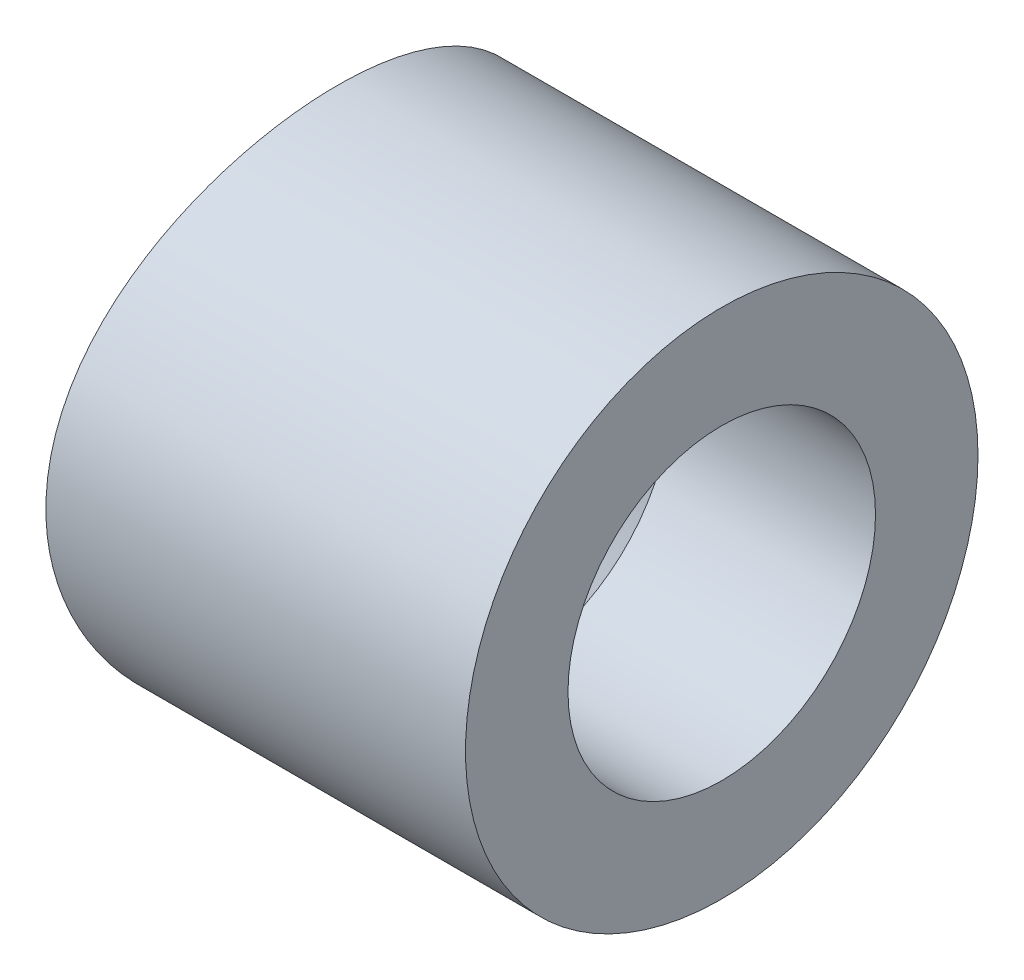
from build123d import *
from build123d.topology import SkipClean

# Parameters (mm, degrees)
SKETCH2_R                            = 23.495
INITIAL_DISK_DEPTH                   = 7.62
HOLLOW_START                         = 54.61
HOLLOW_CYLINDER_DEPTH                = 54.61
SKETCH5_R                            = 1.524
Y_SERVO_HOLE_1_DEPTH                 = 9.398
SKETCH8_R                            = 3.175
Y_SERVO_HOLE_3_DEPTH                 = 5.715
BOSS_EXTRUDE2_REACH                  = 65.924
BOSS_EXTRUDE2_DIRECTION_2_REACH      = 65.924
CUT_EXTRUDE3_DEPTH                   = 64.924034212
SKETCH9_W                            = 2.54
SKETCH9_H                            = 30.48
X_SERVO_TOP_MOUNT_DEPTH              = 6.35
FILLET3_START                        = -22
FILLET3_DEPTH                        = 45.495
SKETCH11_R                           = 2.286
X_SERVO_TOP_HOLES_DEPTH              = 2.54
X_START                              = 6.858
X_SERVO_BOTTOM_MOUNT_DEPTH           = 6.858
SKETCH14_R                           = 2.3495
X_SERVO_BOTTOM_HOLES_DEPTH           = 6.35
SKETCH15_R                           = 4.445
X_SERVO_BOTTOM_SCREW_CLEARANCE_DEPTH = 16.51
SKETCH18_W                           = 5.08
SKETCH18_H                           = 22.86
CUT_EXTRUDE2_DEPTH                   = 2.54
FILLET1_R                            = 1.27
BOSS_EXTRUDE1_DEPTH                  = 1.905
BOSS_EXTRUDE3_REACH                  = 70.14
SKETCH23_W                           = 1.905
SKETCH23_H                           = 0.757768233
BOSS_EXTRUDE4_DEPTH                  = 2.54
SKETCH24_R                           = 0.6096
CUT_EXTRUDE4_DEPTH                   = 10.16
BOSS_EXTRUDE5_REACH                  = 84.026
BOSS_EXTRUDE5_END_RADIUS             = 23.495
SKETCH16_R                           = 6.35
SKETCH16_R_2                         = 3.81
SKETCH26_R                           = 23.495
CUT_EXTRUDE5_DEPTH                   = 76.2
BOSS_EXTRUDE6_START                  = 33.2739999
BOSS_EXTRUDE6_DEPTH                  = 7.6200001
SKETCH29_R                           = 1.143
CUT_EXTRUDE6_DEPTH                   = 5.08
CHAMFER1_SIZE                        = 1.27


with BuildPart() as part:
    # Sketch2 → Initial Disk (new body)
    with BuildSketch(Plane(origin=(0, 0, 0), x_dir=(1, 0, 0), z_dir=(0, 1, 0))):
        with Locations(Location((0, 0, 0), (0, 0, 270))):
            Circle(SKETCH2_R)
    extrude(amount=-INITIAL_DISK_DEPTH)

    # Sketch3 → Hollow Cylinder (add)
    with SkipClean():  # the faces are left unmerged after this step: merging them gives an invalid solid
        with BuildSketch(Plane(origin=(0, 0, 0), x_dir=(1, 0, 0), z_dir=(0, 1, 0)).offset(HOLLOW_START)):
            with BuildLine():
                Line((-17.770847855, 11.104458182), (-20.705217543, 11.104458182))
                ThreePointArc((-20.705217543, 11.104458182), (23.495, 0), (-20.705217543, -11.104458182))
                Line((-20.705217543, -11.104458182), (-17.770847855, -11.104458182))
                ThreePointArc((-17.770847855, -11.104458182), (20.955, 0), (-17.770847855, 11.104458182))
            make_face()
        extrude(amount=-HOLLOW_CYLINDER_DEPTH)

    # Sketch5 → Y Servo Hole 1 (cut)
    with SkipClean():  # the faces are left unmerged after this step: merging them gives an invalid solid
        with BuildSketch(Plane.XZ.offset(7.62)):
            with Locations(Location((0, 0, 0), (0, 0, 270))):
                Circle(SKETCH5_R)
        extrude(amount=-Y_SERVO_HOLE_1_DEPTH, mode=Mode.SUBTRACT)

    # Sketch8 → Y Servo Hole 3 (cut)
    with SkipClean():  # the faces are left unmerged after this step: merging them gives an invalid solid
        with BuildSketch(Plane(origin=(0, 0, 0), x_dir=(1, 0, 0), z_dir=(0, 1, 0))):
            with Locations(Location((0, 0, 0), (0, 0, 270))):
                Circle(SKETCH8_R)
        extrude(amount=-Y_SERVO_HOLE_3_DEPTH, mode=Mode.SUBTRACT)

    # Sketch20 → Boss-Extrude2 (add, up to next)
    with BuildSketch(Plane(origin=(0, 0, 0), x_dir=(0, 0, -1), z_dir=(1, 0, 0)), mode=Mode.PRIVATE) as boss_extrude2_sk1:
        Polygon((23.495, 41.342827261), (14.205225637, 54.61), (11.104458182, 54.61), (21.414353808, 39.885943113), align=None)
    boss_extrude2_tool1 = extrude(boss_extrude2_sk1.sketch, amount=BOSS_EXTRUDE2_REACH, mode=Mode.PRIVATE) - part.part
    boss_extrude2 = boss_extrude2_tool1.solids().sort_by_distance((0, 47.605874, -17.532286))[0]
    add(boss_extrude2)

    # Sketch20 → Boss-Extrude2 direction 2 (add, up to next)
    with BuildSketch(Plane(origin=(0, 0, 0), x_dir=(0, 0, -1), z_dir=(1, 0, 0)), mode=Mode.PRIVATE) as boss_extrude2_direction_2_sk1:
        Polygon((23.495, 41.342827261), (14.205225637, 54.61), (11.104458182, 54.61), (21.414353808, 39.885943113), align=None)
    boss_extrude2_direction_2_tool1 = extrude(boss_extrude2_direction_2_sk1.sketch, amount=-BOSS_EXTRUDE2_DIRECTION_2_REACH, mode=Mode.PRIVATE) - part.part
    boss_extrude2_direction_2 = boss_extrude2_direction_2_tool1.solids().sort_by_distance((0, 47.605874, -17.532286))[0]
    add(boss_extrude2_direction_2)

    # Sketch21 → Cut-Extrude3 (cut, symmetric)
    with SkipClean():  # the faces are left unmerged after this step: merging them gives an invalid solid
        with BuildSketch(Plane(origin=(0, 0, 0), x_dir=(0, 0, -1), z_dir=(1, 0, 0))):
            Polygon((23.495, 54.61), (14.205225637, 54.61), (23.495, 41.342827261), align=None)
        cut_extrude3 = extrude(amount=CUT_EXTRUDE3_DEPTH, both=True, mode=Mode.SUBTRACT)

    # Mirror2: Boss-Extrude2, Boss-Extrude2 direction 2, Cut-Extrude3 across plane
    with SkipClean():  # the faces are left unmerged after this step: merging them gives an invalid solid
        add(boss_extrude2.mirror(Plane.XY))
        add(boss_extrude2_direction_2.mirror(Plane.XY))
        add(cut_extrude3.mirror(Plane.XY), mode=Mode.SUBTRACT)

    # Sketch9 → X Servo Top Mount (add)
    with SkipClean():  # the faces are left unmerged after this step: merging them gives an invalid solid
        with BuildSketch(Plane(origin=(0, 54.61, 0), x_dir=(1, 0, 0), z_dir=(0, 1, 0))):
            with Locations((-8.5344, 0)):
                Rectangle(SKETCH9_W, SKETCH9_H)
        extrude(amount=-X_SERVO_TOP_MOUNT_DEPTH)

    # Fillet3: read off the stored shape, not the designer's step
    # Fillet3 outline → Fillet3 (cut)
    with SkipClean():  # the faces are left unmerged after this step: merging them gives an invalid solid
        with BuildSketch(Plane.YZ.offset(FILLET3_START)):
            with BuildLine():
                Line((53.132189057, 15.24), (50.819094519, 16.859646232))
                ThreePointArc((50.819094519, 16.859646232), (53.605526779, 13.682328823), (54.61, 9.577382514))
                Line((54.61, 9.577382514), (54.61, 15.24))
                Line((54.61, 15.24), (53.132189057, 15.24))
            make_face()
            with BuildLine():
                ThreePointArc((54.61, -9.577384558), (53.605525966, -13.682330385), (50.81909331, -16.859647079))
                Line((50.81909331, -16.859647079), (53.132189057, -15.24))
                Line((53.132189057, -15.24), (54.61, -15.24))
                Line((54.61, -15.24), (54.61, -9.577384558))
            make_face()
        extrude(amount=FILLET3_DEPTH, mode=Mode.SUBTRACT)

    # Sketch11 → X Servo Top Holes (cut)
    with SkipClean():  # the faces are left unmerged after this step: merging them gives an invalid solid
        with BuildSketch(Plane.ZY.offset(9.8044)):
            with Locations((-4.953, 51.689)):
                Circle(SKETCH11_R)
            with Locations(Location((4.953, 51.689, 0), (0, 0, 180))):
                Circle(SKETCH11_R)
        extrude(amount=-X_SERVO_TOP_HOLES_DEPTH, mode=Mode.SUBTRACT)

    # Sketch13 → X Servo Bottom Mount (add)
    with SkipClean():  # the faces are left unmerged after this step: merging them gives an invalid solid
        with BuildSketch(Plane(origin=(0, 0, 0), x_dir=(1, 0, 0), z_dir=(0, 1, 0)).offset(X_START)):
            with BuildLine():
                Line((-9.8044, 18.519874882), (-9.8044, -18.519874882))
                ThreePointArc((-9.8044, -18.519874882), (-8.553269609, -19.129913852), (-7.2644, -19.65554674))
                Line((-7.2644, -19.65554674), (-7.2644, 19.65554674))
                ThreePointArc((-7.2644, 19.65554674), (-8.553269609, 19.129913852), (-9.8044, 18.519874882))
            make_face()
        extrude(amount=-X_SERVO_BOTTOM_MOUNT_DEPTH)

    # Sketch14 → X Servo Bottom Holes (cut)
    with SkipClean():  # the faces are left unmerged after this step: merging them gives an invalid solid
        with BuildSketch(Plane.ZY.offset(9.8044)):
            with Locations(Location((-4.953, 2.286, 0), (0, 0, 283.351184332))):
                Circle(SKETCH14_R)
            with Locations(Location((4.953, 2.286, 0), (0, 0, 283.351184332))):
                Circle(SKETCH14_R)
        extrude(amount=-X_SERVO_BOTTOM_HOLES_DEPTH, mode=Mode.SUBTRACT)

    # Sketch15 → X Servo Bottom Screw Clearance (cut)
    with SkipClean():  # the faces are left unmerged after this step: merging them gives an invalid solid
        with BuildSketch(Plane.ZY.offset(9.8044)):
            with Locations((-4.9784, 2.98958)):
                Circle(SKETCH15_R)
            with Locations((4.9784, 2.98958)):
                Circle(SKETCH15_R)
        extrude(amount=X_SERVO_BOTTOM_SCREW_CLEARANCE_DEPTH, mode=Mode.SUBTRACT)

    # Sketch18 → Cut-Extrude2 (cut)
    with SkipClean():  # the faces are left unmerged after this step: merging them gives an invalid solid
        with BuildSketch(Plane(origin=(0, 0, 0), x_dir=(1, 0, 0), z_dir=(0, 1, 0))):
            with Locations((-4.7244, 0)):
                Rectangle(SKETCH18_W, SKETCH18_H)
        extrude(amount=-CUT_EXTRUDE2_DEPTH, mode=Mode.SUBTRACT)

    # Fillet1
    fillet1_edges = [part.edges().sort_by_distance(p)[0] for p in [
        (-2.1844, -1.27, 2.304131429),
        (-2.1844, -1.27, -2.304131429),
    ]]
    fillet(fillet1_edges, radius=FILLET1_R)

    # Sketch19 → Boss-Extrude1 (add)
    with SkipClean():  # the faces are left unmerged after this step: merging them gives an invalid solid
        with BuildSketch(Plane(origin=(-7.2644, 0, 0), x_dir=(0, 0, -1), z_dir=(1, 0, 0))):
            Polygon((-8.032586336, 6.858), (-10.672231767, 2.286), (-10.672231767, -2.54), (-8.139638623, -2.54), (-1.766361377, -2.54), (0, -2.54), (0, 1.00284174), (0, 3.61315235), (-1.873413664, 6.858), align=None)
            Polygon((-2.973265927, 5.715), (-6.932734073, 5.715), (-8.912468146, 2.286), (-6.932734073, -1.143), (-2.973265927, -1.143), (-0.993531854, 2.286), align=None, mode=Mode.SUBTRACT)
        boss_extrude1 = extrude(amount=BOSS_EXTRUDE1_DEPTH)

    # Mirror1: Boss-Extrude1 across plane
    with SkipClean():  # the faces are left unmerged after this step: merging them gives an invalid solid
        add(boss_extrude1.mirror(Plane.XY))

    # Sketch22 → Boss-Extrude3 (add, up to next)
    with BuildSketch(Plane.ZY.offset(9.8044), mode=Mode.PRIVATE) as boss_extrude3_sk1:
        with BuildLine():
            ThreePointArc((11.210377262, 54.458731878), (11.157446673, 54.468457219), (11.104458182, 54.477861962))
            Line((11.104458182, 54.477861962), (11.104458182, 48.26))
            Line((11.104458182, 48.26), (15.24, 48.26))
            Line((15.24, 48.26), (15.24, 48.703834196))
            Line((15.24, 48.703834196), (11.210377262, 54.458731878))
        make_face()
    boss_extrude3_tool1 = extrude(boss_extrude3_sk1.sketch, amount=BOSS_EXTRUDE3_REACH, mode=Mode.PRIVATE) - part.part
    # Sketch22 → Boss-Extrude3 (add, up to next)
    with BuildSketch(Plane.ZY.offset(9.8044), mode=Mode.PRIVATE) as boss_extrude3_sk2:
        with BuildLine():
            Line((-15.24, 48.26), (-11.104458182, 48.26))
            Line((-11.104458182, 48.26), (-11.104458182, 54.477861962))
            ThreePointArc((-11.104458182, 54.477861962), (-11.157446673, 54.468457219), (-11.210377262, 54.458731878))
            Line((-11.210377262, 54.458731878), (-15.24, 48.703834196))
            Line((-15.24, 48.703834196), (-15.24, 48.26))
        make_face()
    boss_extrude3_tool2 = extrude(boss_extrude3_sk2.sketch, amount=BOSS_EXTRUDE3_REACH, mode=Mode.PRIVATE) - part.part
    add(boss_extrude3_tool1.solids().sort_by_distance((-9.8044, 50.384277, 12.573742))[0])
    add(boss_extrude3_tool2.solids().sort_by_distance((-9.8044, 50.384277, -12.573742))[0])

    # Sketch23 → Boss-Extrude4 (add)
    with SkipClean():  # the faces are left unmerged after this step: merging them gives an invalid solid
        with BuildSketch(Plane(origin=(0, -2.54, 0), x_dir=(1, 0, 0), z_dir=(0, 1, 0))):
            with Locations((-6.3119, 11.051115884)):
                Rectangle(SKETCH23_W, SKETCH23_H)
            with Locations((-6.3119, -11.051115884)):
                Rectangle(SKETCH23_W, SKETCH23_H)
        extrude(amount=BOSS_EXTRUDE4_DEPTH)

    # Sketch24 → Cut-Extrude4 (cut)
    with SkipClean():  # the faces are left unmerged after this step: merging them gives an invalid solid
        with BuildSketch(Plane.XZ.offset(7.62)):
            with Locations(Location((0, 6.9977, 0), (0, 0, 270))):
                Circle(SKETCH24_R)
            with Locations(Location((6.9977, 0, 0), (0, 0, 270))):
                Circle(SKETCH24_R)
            with Locations(Location((0, -6.9977, 0), (0, 0, 270))):
                Circle(SKETCH24_R)
        extrude(amount=-CUT_EXTRUDE4_DEPTH, mode=Mode.SUBTRACT)

    # Boss-Extrude5: up to this cylinder (the profile starts outside it)
    with SkipClean():  # the faces are left unmerged after this step: merging them gives an invalid solid
        boss_extrude5_end = Plane(origin=(0, 37.084, 0), z_dir=(0, 1, 0)) * Cylinder(BOSS_EXTRUDE5_END_RADIUS, 216.042, mode=Mode.PRIVATE)
        # Sketch16 → Boss-Extrude5 (add, up to the surface)
        with BuildSketch(Plane(origin=(33.02, 0, 0), x_dir=(0, 0, -1), z_dir=(1, 0, 0)), mode=Mode.PRIVATE) as boss_extrude5_sk1:
            with Locations((0, 37.084)):
                Circle(SKETCH16_R)
            with Locations((0, 37.084)):
                Circle(SKETCH16_R_2, mode=Mode.SUBTRACT)
        boss_extrude5_tool1 = extrude(boss_extrude5_sk1.sketch, amount=-BOSS_EXTRUDE5_REACH, mode=Mode.PRIVATE) - boss_extrude5_end
        add(boss_extrude5_tool1.solids().sort_by_distance((33.02, 37.084, 6.170395))[0])

    # Sketch26 → Cut-Extrude5 (cut)
    with BuildSketch(Plane(origin=(0, 54.61, 0), x_dir=(1, 0, 0), z_dir=(0, 1, 0))):
        Circle(SKETCH26_R)
    extrude(amount=-CUT_EXTRUDE5_DEPTH, mode=Mode.SUBTRACT)

    # Boss-Extrude6: read off the stored shape, not the designer's step
    # Boss-Extrude6 outline → Boss-Extrude6 (add)
    with BuildSketch(Plane(origin=(0, 0, 0), x_dir=(1, 0, 0), z_dir=(0, 1, 0)).offset(BOSS_EXTRUDE6_START)):
        with BuildLine():
            ThreePointArc((22.956807814, 5), (23.495, 0), (22.956807814, -5))
            Line((22.956807814, -5), (26.67, -5))
            Line((26.67, -5), (26.67, 5))
            Line((26.67, 5), (22.956807814, 5))
        make_face()
    extrude(amount=BOSS_EXTRUDE6_DEPTH)

    # Sketch29 → Cut-Extrude6 (cut)
    with BuildSketch(Plane(origin=(26.67, 0, 0), x_dir=(0, 0, -1), z_dir=(1, 0, 0))):
        with Locations((0, 37.084)):
            Circle(SKETCH29_R)
    extrude(amount=-CUT_EXTRUDE6_DEPTH, mode=Mode.SUBTRACT)

    # Chamfer1
    chamfer1_edges = [part.edges().sort_by_distance(p)[0] for p in [
        (26.67, 37.084, 3.81),
    ]]
    chamfer(chamfer1_edges, length=CHAMFER1_SIZE)


solid = part.part
